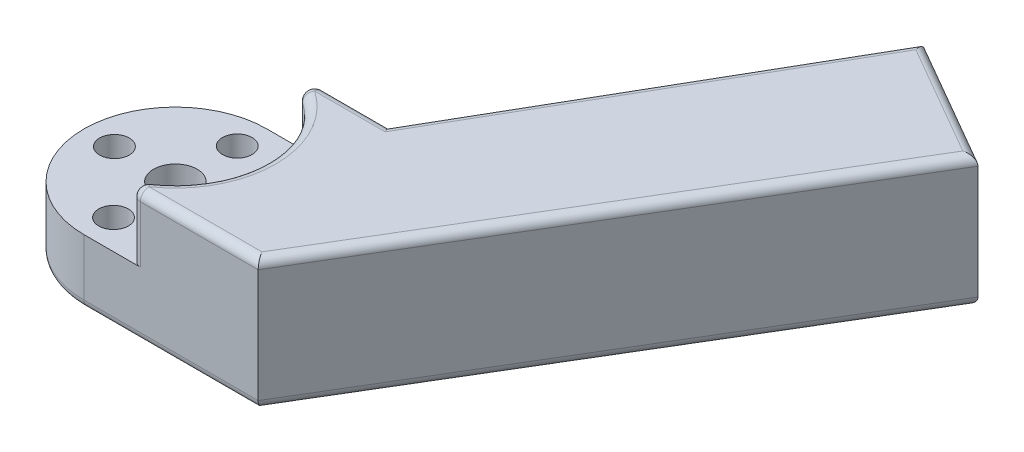
from build123d import *

# Parameters (mm, degrees)
BOSS_EXTRUDE1_DEPTH = 15
SKETCH2_R           = 10.5
BOSS_EXTRUDE2_DEPTH = 7.5
FILLET1_START       = 7.5
FILLET1_DEPTH       = 8.5
SKETCH3_R           = 2.5
SKETCH3_R_2         = 1.7
CUT_EXTRUDE1_DEPTH  = 72.448988785
FILLET4_R           = 1


with BuildPart() as part:
    # Sketch1 → Boss-Extrude1 (new body)
    with BuildSketch(Plane(origin=(0, 0, 0), x_dir=(1, 0, 0), z_dir=(0, 1, 0))):
        with BuildLine():
            ThreePointArc((10.5, 0), (7.424621202, -7.424621202), (0, -10.5))
            Line((0, -10.5), (20, -10.5))
            Line((20, -10.5), (51.003078258, 41.097787034))
            Line((51.003078258, 41.097787034), (36.5, 49.47114317))
            Line((36.5, 49.47114317), (14, 10.5))
            Line((14, 10.5), (0, 10.5))
            ThreePointArc((0, 10.5), (7.424621202, 7.424621202), (10.5, 0))
        make_face()
    extrude(amount=BOSS_EXTRUDE1_DEPTH)

    # Sketch2 → Boss-Extrude2 (add)
    with BuildSketch(Plane(origin=(0, 0, 0), x_dir=(1, 0, 0), z_dir=(0, 1, 0))):
        Circle(SKETCH2_R)
    extrude(amount=BOSS_EXTRUDE2_DEPTH)

    # Fillet1: read off the stored shape, not the designer's step
    # Fillet1 outline → Fillet1 (cut)
    with BuildSketch(Plane(origin=(0, 0, 0), x_dir=(1, 0, 0), z_dir=(0, 1, 0)).offset(FILLET1_START)):
        with BuildLine():
            ThreePointArc((0, 10.5), (3.096281079, 10.033097402), (5.917198029, 8.673913043))
            ThreePointArc((5.917198029, 8.673913043), (5.525207613, 9.794883912), (6.480740698, 10.5))
            Line((6.480740698, 10.5), (0, 10.5))
        make_face()
        with BuildLine():
            ThreePointArc((6.480740698, -10.5), (5.525207613, -9.794883912), (5.917198029, -8.673913043))
            ThreePointArc((5.917198029, -8.673913043), (3.096281079, -10.033097402), (0, -10.5))
            Line((0, -10.5), (6.480740698, -10.5))
        make_face()
    extrude(amount=FILLET1_DEPTH, mode=Mode.SUBTRACT)

    # Sketch3 → Cut-Extrude1 (cut, through all)
    with BuildSketch(Plane(origin=(0, 7.5, 0), x_dir=(1, 0, 0), z_dir=(0, 1, 0))):
        with Locations(Location((0, 0, 0), (0, 0, 270))):
            Circle(SKETCH3_R)
        with Locations(Location((0, 7.1, 0), (0, 0, 270))):
            Circle(SKETCH3_R_2)
        with Locations(Location((0, -7.1, 0), (0, 0, 270))):
            Circle(SKETCH3_R_2)
        with Locations(Location((-7, 0, 0), (0, 0, 270))):
            Circle(SKETCH3_R_2)
        with Locations(Location((7.2, 0, 0), (0, 0, 270))):
            Circle(SKETCH3_R_2)
    extrude(amount=-CUT_EXTRUDE1_DEPTH, mode=Mode.SUBTRACT)

    # Fillet4
    # the kernel refuses this fillet: 1 mm, written as the material it takes off along each edge
    with BuildSketch(Plane(origin=(18.712404813, 15, 12.642918252), x_dir=(0, -1, 0), z_dir=(0.5150380749100582, 0, -0.85716730070211))) as fillet4_piece_1:
        with BuildLine():
            CenterArc((FILLET4_R, FILLET4_R), FILLET4_R, 180, 90)
            Line((0, FILLET4_R), (0, 0))
            Line((0, 0), (FILLET4_R, 0))
        make_face()
    extrude(amount=65.195701576, mode=Mode.SUBTRACT)
    with BuildSketch(Plane(origin=(53.168141767, 15, -39.847787034), x_dir=(0, -1, 0), z_dir=(-0.8660254037844399, 0, -0.49999999999999795))) as fillet4_piece_2:
        with BuildLine():
            CenterArc((FILLET4_R, FILLET4_R), FILLET4_R, 180, 90)
            Line((0, FILLET4_R), (0, 0))
            Line((0, 0), (FILLET4_R, 0))
        make_face()
    extrude(amount=21.746712272, mode=Mode.SUBTRACT)
    with BuildSketch(Plane(origin=(0, 0, 0), x_dir=(0, 0, -1), z_dir=(1, 0, 0))) as fillet4_piece_3:
        with BuildLine():
            CenterArc((10.5 - FILLET4_R, FILLET4_R), FILLET4_R, 270, 90)
            Line((10.5, FILLET4_R), (10.5, 0))
            Line((10.5, 0), (10.5 - FILLET4_R, 0))
        make_face()
    revolve(axis=Axis((0, 0, 0), (0, 1, 0)), revolution_arc=180, mode=Mode.SUBTRACT)
    with BuildSketch(Plane(origin=(37.75, 15, -51.63620668), x_dir=(0.8660254037844399, 0, 0.4999999999999977), z_dir=(-0.4999999999999977, 0, 0.8660254037844399))) as fillet4_piece_4_section:
        with BuildLine():
            CenterArc((FILLET4_R, -FILLET4_R), FILLET4_R, 90, 90)
            Line((0, -FILLET4_R), (0, 0))
            Line((0, 0), (FILLET4_R, 0))
        make_face()
    fillet4_piece_4 = extrude(amount=50, mode=Mode.PRIVATE)
    fillet4_piece_4 = split(fillet4_piece_4, bisect_by=Plane(origin=(37.75, 15, -10.5), z_dir=(0, 0, -1)), keep=Keep.TOP, mode=Mode.PRIVATE)
    add(fillet4_piece_4, mode=Mode.SUBTRACT)
    with BuildSketch(Plane(origin=(0, 15, 0), x_dir=(0.563542669449255, 0, 0.8260869565064005), z_dir=(-0.8260869565064005, 0, 0.563542669449255))) as fillet4_piece_5:
        with BuildLine():
            CenterArc((10.5 + FILLET4_R, -FILLET4_R), FILLET4_R, 90, 90)
            Line((10.5, -FILLET4_R), (10.5, 0))
            Line((10.5, 0), (10.5 + FILLET4_R, 0))
        make_face()
    revolve(axis=Axis((0, 15, 0), (0, 1, 0)), revolution_arc=111.397694483, mode=Mode.SUBTRACT)
    with BuildSketch(Plane(origin=(16.5, 15, -10.5), x_dir=(0, 0, 1), z_dir=(-1, 0, 0))) as fillet4_piece_6_section:
        with BuildLine():
            CenterArc((FILLET4_R, -FILLET4_R), FILLET4_R, 90, 90)
            Line((0, -FILLET4_R), (0, 0))
            Line((0, 0), (FILLET4_R, 0))
        make_face()
    fillet4_piece_6 = extrude(amount=10.019259302, mode=Mode.PRIVATE)
    fillet4_piece_6 = split(fillet4_piece_6, bisect_by=Plane(origin=(14.625, 15, -11.582531755), z_dir=(-0.8660254037844399, 0, -0.4999999999999977)), keep=Keep.TOP, mode=Mode.PRIVATE)
    add(fillet4_piece_6, mode=Mode.SUBTRACT)
    with BuildSketch(Plane(origin=(6.480740698, 15, 10.5), x_dir=(0, -1, 0), z_dir=(1, 0, 0))) as fillet4_piece_7:
        with BuildLine():
            CenterArc((FILLET4_R, FILLET4_R), FILLET4_R, 180, 90)
            Line((0, FILLET4_R), (0, 0))
            Line((0, 0), (FILLET4_R, 0))
        make_face()
    extrude(amount=16.019259302, mode=Mode.SUBTRACT)
    with BuildSketch(Plane(origin=(6.480740699, 15, 9.499999999), x_dir=(-1.3777317057953908e-09, 0, 1.0), z_dir=(1.0, 0, 1.3777317057953908e-09))) as fillet4_piece_8:
        with BuildLine():
            CenterArc((1.000000001 - FILLET4_R, FILLET4_R), FILLET4_R, 270, 90)
            Line((1.000000001, FILLET4_R), (1.000000001, 0))
            Line((1.000000001, 0), (1.000000001 - FILLET4_R, 0))
        make_face()
    revolve(axis=Axis((6.480740699, 15, 9.499999999), (0, -1, 0)), revolution_arc=145.698847118, mode=Mode.SUBTRACT)
    with BuildSketch(Plane(origin=(6.480740699, 15, -9.499999999), x_dir=(-0.5635426700904216, 0, 0.8260869560690076), z_dir=(0.8260869560690076, 0, 0.5635426700904216))) as fillet4_piece_9:
        with BuildLine():
            CenterArc((1.000000001 - FILLET4_R, FILLET4_R), FILLET4_R, 270, 90)
            Line((1.000000001, FILLET4_R), (1.000000001, 0))
            Line((1.000000001, 0), (1.000000001 - FILLET4_R, 0))
        make_face()
    revolve(axis=Axis((6.480740699, 15, -9.499999999), (0, -1, 0)), revolution_arc=145.698847118, mode=Mode.SUBTRACT)
    with BuildSketch(Plane(origin=(0, 0, -7.1), x_dir=(0, 0, 1), z_dir=(-1, 0, 0))) as fillet4_piece_10:
        with BuildLine():
            CenterArc((1.7 + FILLET4_R, FILLET4_R), FILLET4_R, 180, 90)
            Line((1.7, FILLET4_R), (1.7, 0))
            Line((1.7, 0), (1.7 + FILLET4_R, 0))
        make_face()
    revolve(axis=Axis((0, 0, -7.1), (0, 1, 0)), mode=Mode.SUBTRACT)
    with BuildSketch(Plane(origin=(0, 0, 7.1), x_dir=(0, 0, 1), z_dir=(-1, 0, 0))) as fillet4_piece_11:
        with BuildLine():
            CenterArc((1.7 + FILLET4_R, FILLET4_R), FILLET4_R, 180, 90)
            Line((1.7, FILLET4_R), (1.7, 0))
            Line((1.7, 0), (1.7 + FILLET4_R, 0))
        make_face()
    revolve(axis=Axis((0, 0, 7.1), (0, 1, 0)), mode=Mode.SUBTRACT)
    with BuildSketch(Plane(origin=(-7, 0, 0), x_dir=(0, 0, 1), z_dir=(-1, 0, 0))) as fillet4_piece_12:
        with BuildLine():
            CenterArc((1.7 + FILLET4_R, FILLET4_R), FILLET4_R, 180, 90)
            Line((1.7, FILLET4_R), (1.7, 0))
            Line((1.7, 0), (1.7 + FILLET4_R, 0))
        make_face()
    revolve(axis=Axis((-7, 0, 0), (0, 1, 0)), mode=Mode.SUBTRACT)
    with BuildSketch(Plane(origin=(7.2, 0, 0), x_dir=(0, 0, 1), z_dir=(-1, 0, 0))) as fillet4_piece_13:
        with BuildLine():
            CenterArc((1.7 + FILLET4_R, FILLET4_R), FILLET4_R, 180, 90)
            Line((1.7, FILLET4_R), (1.7, 0))
            Line((1.7, 0), (1.7 + FILLET4_R, 0))
        make_face()
    revolve(axis=Axis((7.2, 0, 0), (0, 1, 0)), mode=Mode.SUBTRACT)
    with BuildSketch(Plane(origin=(0, 0, 0), x_dir=(0, 0, 1), z_dir=(-1, 0, 0))) as fillet4_piece_14:
        with BuildLine():
            CenterArc((2.5 + FILLET4_R, FILLET4_R), FILLET4_R, 180, 90)
            Line((2.5, FILLET4_R), (2.5, 0))
            Line((2.5, 0), (2.5 + FILLET4_R, 0))
        make_face()
    revolve(axis=Axis((0, 0, 0), (0, 1, 0)), mode=Mode.SUBTRACT)
    with BuildSketch(Plane(origin=(16.5, 0, -10.5), x_dir=(0, 0, 1), z_dir=(-1, 0, 0))) as fillet4_piece_15_section:
        with BuildLine():
            CenterArc((FILLET4_R, FILLET4_R), FILLET4_R, 180, 90)
            Line((0, FILLET4_R), (0, 0))
            Line((0, 0), (FILLET4_R, 0))
        make_face()
    fillet4_piece_15 = extrude(amount=16.5, mode=Mode.PRIVATE)
    fillet4_piece_15 = split(fillet4_piece_15, bisect_by=Plane(origin=(14.625, 0, -11.582531755), z_dir=(-0.8660254037844399, 0, -0.4999999999999977)), keep=Keep.TOP, mode=Mode.PRIVATE)
    add(fillet4_piece_15, mode=Mode.SUBTRACT)
    with BuildSketch(Plane(origin=(37.75, 0, -51.63620668), x_dir=(0.8660254037844399, 0, 0.4999999999999977), z_dir=(-0.4999999999999977, 0, 0.8660254037844399))) as fillet4_piece_16_section:
        with BuildLine():
            CenterArc((FILLET4_R, FILLET4_R), FILLET4_R, 180, 90)
            Line((0, FILLET4_R), (0, 0))
            Line((0, 0), (FILLET4_R, 0))
        make_face()
    fillet4_piece_16 = extrude(amount=50, mode=Mode.PRIVATE)
    fillet4_piece_16 = split(fillet4_piece_16, bisect_by=Plane(origin=(37.75, 0, -10.5), z_dir=(0, 0, -1)), keep=Keep.TOP, mode=Mode.PRIVATE)
    add(fillet4_piece_16, mode=Mode.SUBTRACT)
    with BuildSketch(Plane(origin=(53.168141767, 0, -39.847787034), x_dir=(0, 1, 0), z_dir=(-0.8660254037844399, 0, -0.49999999999999795))) as fillet4_piece_17:
        with BuildLine():
            CenterArc((FILLET4_R, -FILLET4_R), FILLET4_R, 90, 90)
            Line((0, -FILLET4_R), (0, 0))
            Line((0, 0), (FILLET4_R, 0))
        make_face()
    extrude(amount=21.746712272, mode=Mode.SUBTRACT)
    with BuildSketch(Plane(origin=(18.712404813, 0, 12.642918252), x_dir=(0, 1, 0), z_dir=(0.5150380749100582, 0, -0.85716730070211))) as fillet4_piece_18:
        with BuildLine():
            CenterArc((FILLET4_R, -FILLET4_R), FILLET4_R, 90, 90)
            Line((0, -FILLET4_R), (0, 0))
            Line((0, 0), (FILLET4_R, 0))
        make_face()
    extrude(amount=65.195701576, mode=Mode.SUBTRACT)
    with BuildSketch(Plane(origin=(0, 0, 10.5), x_dir=(0, 1, 0), z_dir=(1, 0, 0))) as fillet4_piece_19:
        with BuildLine():
            CenterArc((FILLET4_R, -FILLET4_R), FILLET4_R, 90, 90)
            Line((0, -FILLET4_R), (0, 0))
            Line((0, 0), (FILLET4_R, 0))
        make_face()
    extrude(amount=22.5, mode=Mode.SUBTRACT)
    with BuildSketch(Plane(origin=(16.5, 15, -10.5), x_dir=(0, 0, 1), z_dir=(-1, 0, 0))) as fillet4_piece_20a_section:
        with BuildLine():
            CenterArc((FILLET4_R, -FILLET4_R), FILLET4_R, 90, 90)
            Line((0, -FILLET4_R), (0, 0))
            Line((0, 0), (FILLET4_R, 0))
        make_face()
    fillet4_piece_20a = extrude(amount=10.019259302, mode=Mode.PRIVATE)
    fillet4_piece_20a = split(fillet4_piece_20a, bisect_by=Plane(origin=(14.625, 15, -11.582531755), z_dir=(0.8660254037844399, 0, 0.4999999999999977)), keep=Keep.TOP, mode=Mode.PRIVATE)
    with BuildSketch(Plane(origin=(37.75, 15, -51.63620668), x_dir=(0.8660254037844399, 0, 0.4999999999999977), z_dir=(-0.4999999999999977, 0, 0.8660254037844399))) as fillet4_piece_20b_section:
        with BuildLine():
            CenterArc((FILLET4_R, -FILLET4_R), FILLET4_R, 90, 90)
            Line((0, -FILLET4_R), (0, 0))
            Line((0, 0), (FILLET4_R, 0))
        make_face()
    fillet4_piece_20b = extrude(amount=50, mode=Mode.PRIVATE)
    fillet4_piece_20b = split(fillet4_piece_20b, bisect_by=Plane(origin=(37.75, 15, -10.5), z_dir=(0, 0, 1)), keep=Keep.TOP, mode=Mode.PRIVATE)
    fillet4_piece_20 = fillet4_piece_20a & fillet4_piece_20b
    add(fillet4_piece_20, mode=Mode.SUBTRACT)
    with BuildSketch(Plane(origin=(37.75, 0, -51.63620668), x_dir=(0.8660254037844399, 0, 0.4999999999999977), z_dir=(-0.4999999999999977, 0, 0.8660254037844399))) as fillet4_piece_21a_section:
        with BuildLine():
            CenterArc((FILLET4_R, FILLET4_R), FILLET4_R, 180, 90)
            Line((0, FILLET4_R), (0, 0))
            Line((0, 0), (FILLET4_R, 0))
        make_face()
    fillet4_piece_21a = extrude(amount=50, mode=Mode.PRIVATE)
    fillet4_piece_21a = split(fillet4_piece_21a, bisect_by=Plane(origin=(37.75, 0, -10.5), z_dir=(0, 0, 1)), keep=Keep.TOP, mode=Mode.PRIVATE)
    with BuildSketch(Plane(origin=(16.5, 0, -10.5), x_dir=(0, 0, 1), z_dir=(-1, 0, 0))) as fillet4_piece_21b_section:
        with BuildLine():
            CenterArc((FILLET4_R, FILLET4_R), FILLET4_R, 180, 90)
            Line((0, FILLET4_R), (0, 0))
            Line((0, 0), (FILLET4_R, 0))
        make_face()
    fillet4_piece_21b = extrude(amount=16.5, mode=Mode.PRIVATE)
    fillet4_piece_21b = split(fillet4_piece_21b, bisect_by=Plane(origin=(14.625, 0, -11.582531755), z_dir=(0.8660254037844399, 0, 0.4999999999999977)), keep=Keep.TOP, mode=Mode.PRIVATE)
    fillet4_piece_21 = fillet4_piece_21a & fillet4_piece_21b
    add(fillet4_piece_21, mode=Mode.SUBTRACT)


solid = part.part
